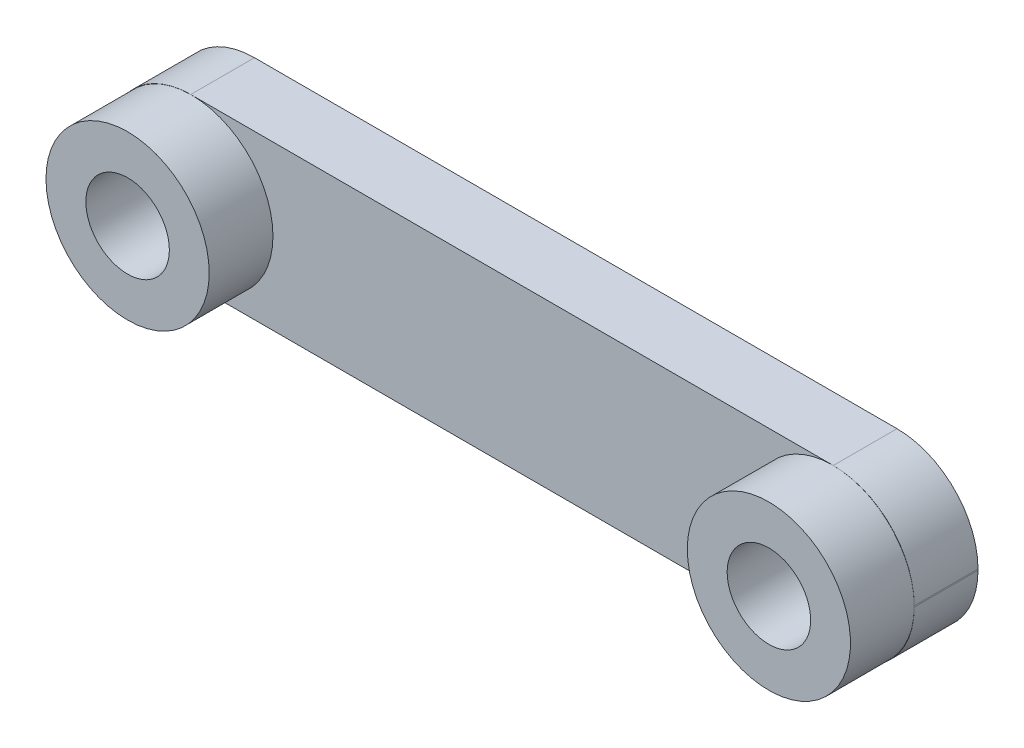
from build123d import *

# Parameters (mm, degrees)
SKETCH2_W           = 126.19
SKETCH2_H           = 25.6
BOSS_EXTRUDE1_DEPTH = 10
SKETCH3_R           = 12.8
SKETCH3_R_2         = 6.55
BOSS_EXTRUDE2_DEPTH = 10
FILLET2_R           = 12.7
CUT_EXTRUDE1_START  = -5.6
SKETCH4_R           = 6.55
CUT_EXTRUDE1_DEPTH  = 5.6


with BuildPart() as part:
    # Sketch2 → Boss-Extrude1 (new body)
    with BuildSketch(Plane.XY):
        Rectangle(SKETCH2_W, SKETCH2_H)
    extrude(amount=BOSS_EXTRUDE1_DEPTH)

    # Sketch3 → Boss-Extrude2 (add)
    with BuildSketch(Plane.XY.offset(10)):
        with Locations(Location((-50.296, 0, 0), (0, 0, 179.283798093))):
            Circle(SKETCH3_R)
        with Locations((-50.296, 0)):
            Circle(SKETCH3_R_2, mode=Mode.SUBTRACT)
    boss_extrude2 = extrude(amount=BOSS_EXTRUDE2_DEPTH)

    # Mirror1: Boss-Extrude2 across plane
    add(boss_extrude2.mirror(Plane(origin=(0, 0, 0), x_dir=(0, 0, 1), z_dir=(1, 0, 0))))

    # Fillet2
    # the kernel refuses this fillet: 12.7 mm, written as the material it takes off along each edge
    with BuildSketch(Plane(origin=(-63.095, -12.8, -31.75), x_dir=(0, 1, 0), z_dir=(0, 0, 1)), Plane(origin=(-63.095, 12.8, -31.75), x_dir=(1, 0, 0), z_dir=(0, 0, 1))) as fillet2_piece_1:
        with BuildLine():
            CenterArc((FILLET2_R, -FILLET2_R), FILLET2_R, 90, 90)
            Line((0, -FILLET2_R), (0, 0))
            Line((0, 0), (FILLET2_R, 0))
        make_face()
    extrude(amount=73.5, mode=Mode.SUBTRACT)
    with BuildSketch(Plane(origin=(63.095, -12.8, -31.75), x_dir=(0, 1, 0), z_dir=(0, 0, 1)), Plane(origin=(63.095, 12.8, -31.75), x_dir=(-1, 0, 0), z_dir=(0, 0, 1))) as fillet2_piece_2:
        with BuildLine():
            CenterArc((FILLET2_R, FILLET2_R), FILLET2_R, 180, 90)
            Line((0, FILLET2_R), (0, 0))
            Line((0, 0), (FILLET2_R, 0))
        make_face()
    extrude(amount=73.5, mode=Mode.SUBTRACT)

    # Sketch4 → Cut-Extrude1 (cut)
    with BuildSketch(Plane.XY.offset(10).offset(CUT_EXTRUDE1_START)):
        with Locations((-50.296, 0)):
            Circle(SKETCH4_R)
    cut_extrude1 = extrude(amount=CUT_EXTRUDE1_DEPTH, mode=Mode.SUBTRACT)

    # Mirror2: Cut-Extrude1 across plane
    add(cut_extrude1.mirror(Plane(origin=(0, 0, 0), x_dir=(0, 0, 1), z_dir=(1, 0, 0))), mode=Mode.SUBTRACT)


solid = part.part
